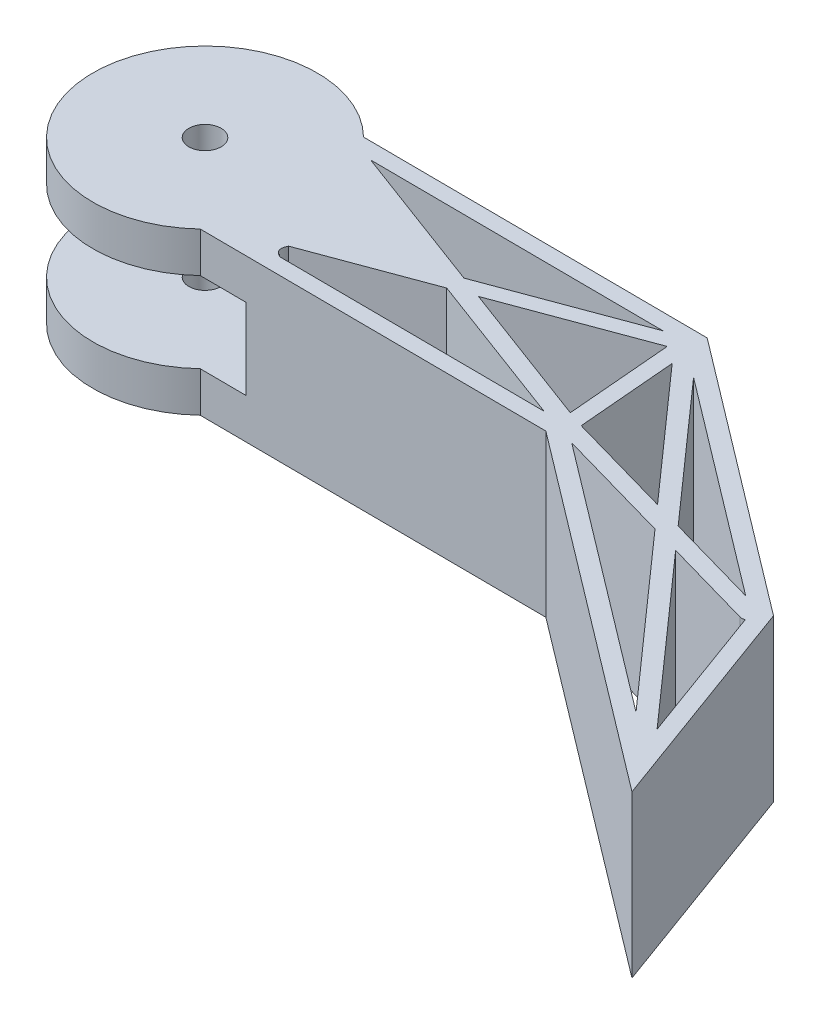
from build123d import *

# Parameters (mm, degrees)
SKETCH2_R           = 2.54
BOSS_EXTRUDE4_DEPTH = 12.7
CUT_EXTRUDE1_START  = -6.35
SKETCH4_R           = 17.653445752
CUT_EXTRUDE1_DEPTH  = 6.35
CUT_EXTRUDE2_DEPTH  = 6.35
CUT_EXTRUDE5_DEPTH  = 110.404841344


with BuildPart() as part:
    # Sketch2 → Boss-Extrude4 (new body)
    with BuildSketch(Plane(origin=(0, 0, 0), x_dir=(1, 0, 0), z_dir=(0, 1, 0))):
        with BuildLine():
            Line((-2.389959661, -19.009464368), (53.576897676, -61.415787029))
            Line((53.576897676, -61.415787029), (40.725407569, -26.278144211))
            Line((40.725407569, -26.278144211), (-2.389947096, 6.390540945))
            Line((-2.389947096, 6.390540945), (-56.832889033, 6.728052684))
            ThreePointArc((-56.832889033, 6.728052684), (-86.902968212, -5.601105462), (-57.146932766, -18.670005835))
            Line((-57.146932766, -18.670005835), (-2.389959661, -19.009464368))
        make_face()
        with Locations((-69.250871823, -5.819371368)):
            Circle(SKETCH2_R, mode=Mode.SUBTRACT)
    boss_extrude4 = extrude(amount=BOSS_EXTRUDE4_DEPTH)

    # Sketch4 → Cut-Extrude1 (cut)
    with BuildSketch(Plane(origin=(0, 12.7, 0), x_dir=(1, 0, 0), z_dir=(0, 1, 0)).offset(CUT_EXTRUDE1_START)):
        with Locations((-69.250871823, -5.819371368)):
            Circle(SKETCH4_R)
    cut_extrude1 = extrude(amount=CUT_EXTRUDE1_DEPTH, mode=Mode.SUBTRACT)

    # Triangleout → Cut-Extrude2 (cut)
    with BuildSketch(Plane(origin=(0, 6.35, 0), x_dir=(1, 0, 0), z_dir=(0, 1, 0))):
        Polygon((-58.106305107, -19.510345754), (-49.455352435, -19.510345754), (-53.093861055, -12.932398146), align=None)
    cut_extrude2 = extrude(amount=CUT_EXTRUDE2_DEPTH, mode=Mode.SUBTRACT)

    # Mirror3: Boss-Extrude4, Cut-Extrude1, Cut-Extrude2 across plane
    add(boss_extrude4.mirror(Plane(origin=(-69.250871823, 12.7, 5.819371368), x_dir=(0, 0, 1), z_dir=(0, -1, 0))))
    add(cut_extrude1.mirror(Plane(origin=(-69.250871823, 12.7, 5.819371368), x_dir=(0, 0, 1), z_dir=(0, -1, 0))), mode=Mode.SUBTRACT)
    add(cut_extrude2.mirror(Plane(origin=(-69.250871823, 12.7, 5.819371368), x_dir=(0, 0, 1), z_dir=(0, -1, 0))), mode=Mode.SUBTRACT)

    # Sketch5 → Cut-Extrude5 (cut, through all)
    with BuildSketch(Plane(origin=(0, 25.4, 0), x_dir=(1, 0, 0), z_dir=(0, 1, 0))):
        with BuildLine():
            Line((24.097552071, -25.06091259), (47.032009387, -50.915826592))
            Line((47.032009387, -50.915826592), (39.032631765, -29.044489394))
            ThreePointArc((39.032631765, -29.044489394), (38.643597603, -29.120884868), (38.249963383, -29.073599049))
            Line((38.249963383, -29.073599049), (24.097552071, -25.06091259))
        make_face()
        Polygon((1.254561033, -18.584153344), (43.045488894, -50.249314753), (19.561377266, -23.77475387), align=None)
        Polygon((-0.3379923, -15.492487006), (16.432547543, -20.247501304), (-1.662395371, 0.151638142), align=None)
        Polygon((1.927077573, -0.06726641), (20.968722347, -21.533660024), (35.812455727, -25.742359631), align=None)
        with BuildLine():
            Line((-47.082485141, -16.192350224), (-5.220163799, -16.451870087))
            Line((-5.220163799, -16.451870087), (-29.698073475, -7.308879759))
            Line((-29.698073475, -7.308879759), (-47.859799508, -14.045584924))
            add(Edge.make_bspline(
                [(-47.082485141, -16.192350224), (-48.634360584, -15.509518544), (-47.859799508, -14.045584924)],
                knots=[0, 0, 0, 1, 1, 1], degree=2))
        make_face()
        Polygon((-26.055910605, -5.957897073), (-2.964059544, -14.583166702), (-4.375083602, 2.08414359), align=None)
        Polygon((-29.694989168, -4.598628224), (-6.842288937, 3.878093835), (-53.157849902, 4.165220962), align=None)
    extrude(amount=-CUT_EXTRUDE5_DEPTH, mode=Mode.SUBTRACT)


solid = part.part
